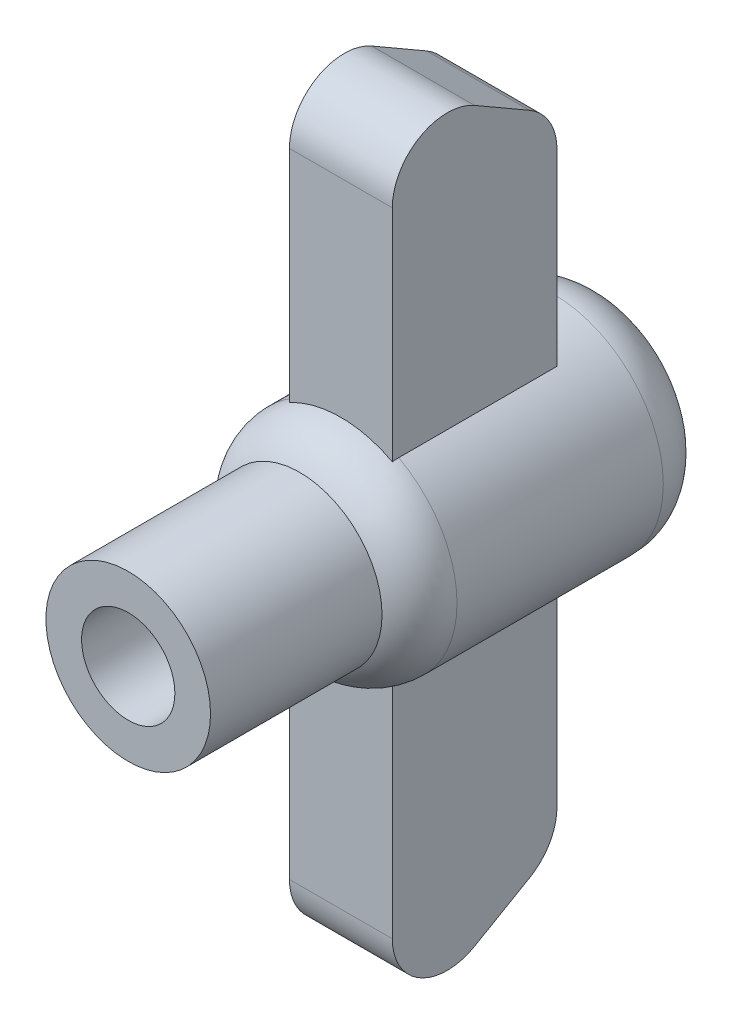
from build123d import *

# Parameters (mm, degrees)
SKETCH4_W               = 7.5
SKETCH4_H               = 12
BOSS_EXTRUDE2_DEPTH     = 30
CUT_EXTRUDE1_DEPTH      = 48.571656477
CUT_EXTRUDE1_DEPTH_BACK = 48.571656477
CUT_EXTRUDE2_DEPTH      = 48.571656477
CUT_EXTRUDE2_DEPTH_BACK = 48.571656477
M8_TAPPED_HOLE2_D       = 6.8
M8_TAPPED_HOLE2_DEPTH   = 20
M8_TAPPED_HOLE2_TIP     = 2.042926105
FILLET1_R               = 4
FILLET2_R               = 4


with BuildPart() as part:
    # Sketch2 → Revolve1 (revolve)
    with BuildSketch(Plane(origin=(0, 0, 0), x_dir=(1, 0, 0), z_dir=(0, 1, 0)), mode=Mode.PRIVATE) as revolve1_sk:
        Polygon((-6, 0), (0, 0), (0, 35), (-8, 35), (-8, 27.5), (-8, 15.5), (-8, 12.5), (-6, 12.5), align=None)
    revolve(revolve1_sk.sketch.rotate(Axis((0, 0, 0), (0, 0, -1)), 180), axis=Axis((0, 0, 0), (0, 0, -1)))

    # Sketch4 → Boss-Extrude2 (add, symmetric)
    with BuildSketch(Plane(origin=(0, 0, 0), x_dir=(1, 0, 0), z_dir=(0, 1, 0))):
        with Locations((0, 21.5)):
            Rectangle(SKETCH4_W, SKETCH4_H)
    extrude(amount=BOSS_EXTRUDE2_DEPTH, both=True)

    # Sketch5 → Cut-Extrude1 (cut, two sides: drawn at the far end of the back side and taken through both)
    with BuildSketch(Plane(origin=(3.75, 0, 0), x_dir=(0, 0, -1), z_dir=(1, 0, 0)).offset(-CUT_EXTRUDE1_DEPTH_BACK)):
        Polygon((15.5, 30), (27.5, 23.07179677), (27.5, 30), align=None)
    extrude(amount=CUT_EXTRUDE1_DEPTH + CUT_EXTRUDE1_DEPTH_BACK, mode=Mode.SUBTRACT)

    # Sketch6 → Cut-Extrude2 (cut, two sides: drawn at the far end of the back side and taken through both)
    with BuildSketch(Plane(origin=(3.75, 0, 0), x_dir=(0, 0, -1), z_dir=(1, 0, 0)).offset(-CUT_EXTRUDE2_DEPTH_BACK)):
        Polygon((15.5, -30), (27.5, -23.07179677), (27.5, -30), align=None)
    extrude(amount=CUT_EXTRUDE2_DEPTH + CUT_EXTRUDE2_DEPTH_BACK, mode=Mode.SUBTRACT)

    # M8 Tapped Hole2
    with Locations(Plane.XY):
        with Locations((0, 0)):
            Hole(M8_TAPPED_HOLE2_D / 2, depth=M8_TAPPED_HOLE2_DEPTH)
            with Locations((0, 0, -(M8_TAPPED_HOLE2_DEPTH + M8_TAPPED_HOLE2_TIP / 2))):  # 118° drill point
                Cone(0, M8_TAPPED_HOLE2_D / 2, M8_TAPPED_HOLE2_TIP, mode=Mode.SUBTRACT)

    # Fillet1
    fillet1_edges = [part.edges().sort_by_distance(p)[0] for p in [
        (0, -30, -15.5),
        (0, 30, -15.5),
        (0, 23.07179677, -27.5),
        (0, -23.07179677, -27.5),
    ]]
    fillet(fillet1_edges, radius=FILLET1_R)

    # Fillet2
    # the kernel refuses this fillet: 4 mm, written as the material it takes off along each edge
    with BuildSketch(Plane(origin=(0, 0, -35), x_dir=(1, 0, 0), z_dir=(0, 1, 0))) as fillet2_piece_1:
        with BuildLine():
            CenterArc((8 - FILLET2_R, -FILLET2_R), FILLET2_R, 0, 90)
            Line((8 - FILLET2_R, 0), (8, 0))
            Line((8, 0), (8, -FILLET2_R))
        make_face()
    revolve(axis=Axis((0, 0, -35), (0, 0, -1)), mode=Mode.SUBTRACT)
    with BuildSketch(Plane(origin=(0, 0, -12.5), x_dir=(1, 0, 0), z_dir=(0, 1, 0))) as fillet2_piece_2_section:
        with BuildLine():
            CenterArc((4, 3.464101615), FILLET2_R, 300, 60)
            Line((6, 0), (8, 0))
            Line((8, 0), (8, 3.464101615))
        make_face()
    fillet2_piece_2 = revolve(axis=Axis((0, 0, -12.5), (0, 0, -1)), mode=Mode.PRIVATE)
    fillet2_piece_2 = split(fillet2_piece_2, bisect_by=Plane(origin=(3.75, -4.120033491, -15.73161152), z_dir=(1, 0, 0)), keep=Keep.TOP, mode=Mode.PRIVATE)
    add(fillet2_piece_2, mode=Mode.SUBTRACT)
    with BuildSketch(Plane(origin=(0, 0, -12.5), x_dir=(1, 0, 0), z_dir=(0, 1, 0))) as fillet2_piece_3_section:
        with BuildLine():
            CenterArc((4, 3.464101615), FILLET2_R, 300, 60)
            Line((6, 0), (8, 0))
            Line((8, 0), (8, 3.464101615))
        make_face()
    fillet2_piece_3 = revolve(axis=Axis((0, 0, -12.5), (0, 0, -1)), mode=Mode.PRIVATE)
    fillet2_piece_3 = split(fillet2_piece_3, bisect_by=Plane(origin=(0, -7.348709995, -15.5), z_dir=(0, 0, 1)), keep=Keep.TOP, mode=Mode.PRIVATE)
    add(fillet2_piece_3, mode=Mode.SUBTRACT)
    with BuildSketch(Plane(origin=(0, 0, -12.5), x_dir=(1, 0, 0), z_dir=(0, 1, 0))) as fillet2_piece_4_section:
        with BuildLine():
            CenterArc((4, 3.464101615), FILLET2_R, 300, 60)
            Line((6, 0), (8, 0))
            Line((8, 0), (8, 3.464101615))
        make_face()
    fillet2_piece_4 = revolve(axis=Axis((0, 0, -12.5), (0, 0, -1)), mode=Mode.PRIVATE)
    fillet2_piece_4 = split(fillet2_piece_4, bisect_by=Plane(origin=(-3.75, 0, -15.73161152), z_dir=(-1, 0, 0)), keep=Keep.TOP, mode=Mode.PRIVATE)
    add(fillet2_piece_4, mode=Mode.SUBTRACT)


solid = part.part
